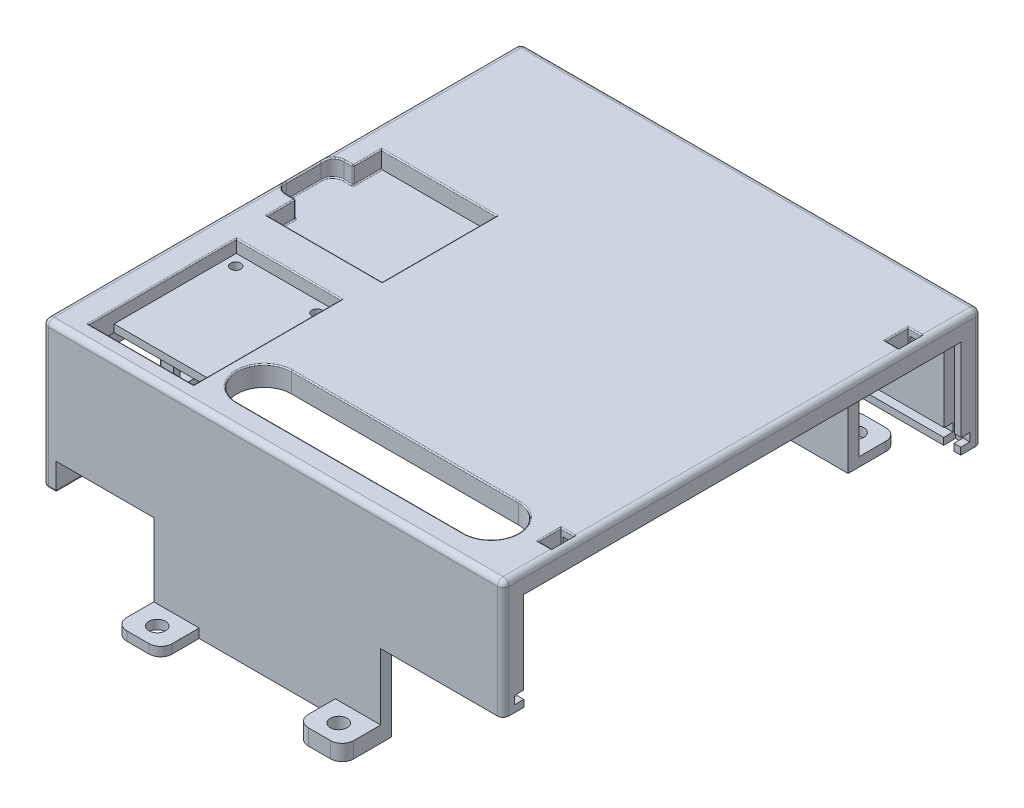
from build123d import *

# Parameters (mm, degrees)
BOSS_EXTRUDE1_DEPTH       = 5.475999969999999
BOSS_EXTRUDE1_DEPTH_BACK  = 93.00000000000006
SKETCH2_R                 = 6.000000000000002
SKETCH2_W                 = 15.829689886761145
SKETCH2_H                 = 13.568305617223942
SKETCH2_W_2               = 35.213904608991875
SKETCH2_H_2               = 19.869660543416312
BOSS_EXTRUDE2_DEPTH       = 3
SKETCH4_W                 = 50.00000000000003
SKETCH4_H                 = 2.400000000000013
SKETCH4_H_2               = 2.3999999999999986
BOSS_EXTRUDE3_DEPTH       = 18.062215133
SKETCH6_W                 = 10.000000000000004
SKETCH6_H                 = 2
SKETCH6_W_2               = 10.000000000000007
BOSS_EXTRUDE4_DEPTH       = 8.5
SKETCH7_W                 = 10.000000000000007
SKETCH7_H                 = 2.0000000000000018
BOSS_EXTRUDE5_DEPTH       = 8.5
F_6_CLEARANCE_HOLE1_D     = 3.6576
F_6_CLEARANCE_HOLE1_DEPTH = 7.62
F_6_CLEARANCE_HOLE1_TIP   = 1.0988539000776023
CUT_EXTRUDE1_DEPTH        = 8.5
CUT_EXTRUDE2_START        = -2.5
CUT_EXTRUDE2_DEPTH        = 101.495879
CUT_EXTRUDE3_DEPTH        = 7.95
CUT_EXTRUDE3_DEPTH_BACK   = 2.5000000000000004
SKETCH13_W                = 3.1000000000000005
SKETCH13_H                = 4.999999999999993
CUT_EXTRUDE4_DEPTH        = 2.794
SKETCH15_W                = 23.11399999999999
SKETCH15_H                = 5.588000000000001
CUT_EXTRUDE5_DEPTH        = 2.794
TAP_DRILL_FOR_4_40_TAP1_D = 2.2606
SKETCH27_W                = 25.32379999999999
SKETCH27_H                = 25.1714
CUT_EXTRUDE6_DEPTH        = 3.8099999999999996
FILLET1_R                 = 1.27
FILLET2_R                 = 1.27
FILLET3_R                 = 1.27
FILLET4_R                 = 0.635
FILLET5_R                 = 0.254
FILLET6_R                 = 0.254
FILLET7_R                 = 2.54
SKETCH28_R                = 1.8287999999999955
BOSS_EXTRUDE7_DEPTH       = 1.5
CUT_EXTRUDE7_DEPTH        = 3.81
FILLET8_R                 = 0.254


# Some blends are built 0.0001 mm under size
with BuildPart() as part:
    # Sketch1 → Boss-Extrude1 (new, two sides: drawn at the far end of the back side and taken through both)
    with BuildSketch(Plane(origin=(0, 0, 0), x_dir=(0, 0, -1), z_dir=(1, 0, 0)).offset(-BOSS_EXTRUDE1_DEPTH_BACK)):
        Polygon((-48.13779143843411, 3.0796649884111265), (-48.13779143843411, 4.601418186900435), (-50.14943480824435, 4.601418186900435), (-50.14943480824435, 6.390822871588028), (-48.24793969226404, 6.390822871588028), (-48.24793969226404, 24.624583150019696), (48.24793969226403, 24.624583150019696), (48.24793969226404, 6.390822871588001), (50.14943480824435, 6.390822871588001), (50.14943480824435, 4.601418186900408), (48.13779143843412, 4.601418186900408), (48.13779143843412, 3.079664988411099), (52.68943480824434, 3.0796649884111127), (52.68943480824434, 8.930822871588001), (52.68943480824434, 29.06607826600001), (-52.68943480824435, 29.066078265999995), (-52.68943480824434, 3.0796649884111407), align=None)
    extrude(amount=BOSS_EXTRUDE1_DEPTH + BOSS_EXTRUDE1_DEPTH_BACK)

    # Sketch2 → Boss-Extrude2 (add)
    with BuildSketch(Plane.ZY.offset(93.00000000000006)):
        Polygon((-52.68943480824434, 29.06607826600001), (52.68943480824434, 29.06607826600001), (52.68943480824434, -3.001942749449555), (-52.68943480824436, -3.001942749449568), align=None)
        with Locations((-38.91314725267847, 11.362022302600375)):
            Circle(SKETCH2_R, mode=Mode.SUBTRACT)
        with Locations((34.72912206967363, 12.140778263538113)):
            Rectangle(SKETCH2_W, SKETCH2_H, mode=Mode.SUBTRACT)
        Polygon((8.044787689133997, 12.819193544399308), (25.45744656457108, 12.819193544399308), (25.45744656457108, 3.676739997555563), (8.044787689133999, 3.676739997555563), align=None, mode=Mode.SUBTRACT)
        with Locations((-13.01457994448496, 13.80130177025359)):
            Rectangle(SKETCH2_W_2, SKETCH2_H_2, mode=Mode.SUBTRACT)
    extrude(amount=BOSS_EXTRUDE2_DEPTH)

    # Sketch4 → Boss-Extrude3 (add)
    with BuildSketch(Plane.XZ.offset(-3.0796649884109524)):
        with Locations((-46.50000000000003, -51.48943480824434)):
            Rectangle(SKETCH4_W, SKETCH4_H)
        with Locations((-46.50000000000003, 51.489434808244326)):
            Rectangle(SKETCH4_W, SKETCH4_H_2)
    extrude(amount=BOSS_EXTRUDE3_DEPTH)

    # Sketch6 → Boss-Extrude4 (add)
    with BuildSketch(Plane(origin=(0, 0, -52.68943480824434), x_dir=(-1, 0, 0), z_dir=(0, 0, -1))):
        with Locations((26.50000000000002, -13.98255014419561)):
            Rectangle(SKETCH6_W, SKETCH6_H)
        with Locations((66.50000000000004, -13.982550144195578)):
            Rectangle(SKETCH6_W_2, SKETCH6_H)
    extrude(amount=BOSS_EXTRUDE4_DEPTH)

    # Sketch7 → Boss-Extrude5 (add)
    with BuildSketch(Plane.XY.offset(52.68943480824434)):
        with Locations((-66.50000000000004, -13.982550144195606)):
            Rectangle(SKETCH7_W, SKETCH7_H)
        Polygon((-21.500000000000018, -14.982550144195638), (-31.50000000000002, -14.98255014419564), (-31.50000000000002, -12.982550144195644), (-21.500000000000018, -12.98255014419564), align=None)
    extrude(amount=BOSS_EXTRUDE5_DEPTH)

    # #6 Clearance Hole1
    with Locations(Plane(origin=(0, -12.982550144195619, 0), x_dir=(1, 0, 0), z_dir=(0, 1, 0))):
        with Locations((-66.5, -56.939434808), (-26.5, -56.939434808), (-26.5, 56.939434808), (-66.5, 56.939434808)):
            Hole(F_6_CLEARANCE_HOLE1_D / 2, depth=F_6_CLEARANCE_HOLE1_DEPTH)
            with Locations((0, 0, -(F_6_CLEARANCE_HOLE1_DEPTH + F_6_CLEARANCE_HOLE1_TIP / 2))):  # 118° drill point
                Cone(0, F_6_CLEARANCE_HOLE1_D / 2, F_6_CLEARANCE_HOLE1_TIP, mode=Mode.SUBTRACT)

    # Sketch11 → Cut-Extrude1 (cut)
    with BuildSketch(Plane(origin=(0, 29.066078266, 3.83e-15), x_dir=(1, 0, 0), z_dir=(0, 1, 0))):
        with BuildLine():
            Line((-58.40000569495746, -35.45524070675196), (-8.400003310771842, -35.45524070675196))
            ThreePointArc((-8.400003310771842, -35.45524070675196), (-2.400003310771849, -41.45524070675195), (-8.400003310771842, -47.455240706751944))
            Line((-8.400003310771842, -47.455240706751944), (-58.40000569495746, -47.455240706751944))
            ThreePointArc((-58.40000569495746, -47.455240706751944), (-64.40000569495746, -41.45524070675195), (-58.40000569495746, -35.45524070675196))
        make_face()
    extrude(amount=-CUT_EXTRUDE1_DEPTH, mode=Mode.SUBTRACT)

    # Sketch12 → Cut-Extrude2 (cut)
    with BuildSketch(Plane.XY.offset(-48.24793969226404).offset(CUT_EXTRUDE2_START)):
        Polygon((1.7259999699999997, 27.56607826599999), (3.9759999699999997, 27.56607826599999), (3.9759999700000033, 3.0796649884110807), (1.7259999700000028, 3.0796649884110807), align=None)
    extrude(amount=CUT_EXTRUDE2_DEPTH, mode=Mode.SUBTRACT)

    # Sketch13 → Cut-Extrude3 (cut, two sides: drawn at the far end of the back side and taken through both)
    with BuildSketch(Plane.XZ.offset(-27.56607826600001).offset(-CUT_EXTRUDE3_DEPTH_BACK)):
        Polygon((1.3009999699999995, 40.74793969226404), (4.40099997, 40.74793969226404), (4.400999969999999, 35.74793969226405), (1.30099997, 35.74793969226405), align=None)
        with Locations((2.8509999699999997, -38.24793969226404)):
            Rectangle(SKETCH13_W, SKETCH13_H)
    extrude(amount=CUT_EXTRUDE3_DEPTH + CUT_EXTRUDE3_DEPTH_BACK, mode=Mode.SUBTRACT)

    # Sketch14 → Cut-Extrude4 (cut)
    with BuildSketch(Plane(origin=(0, 29.066078266, 3.83e-15), x_dir=(1, 0, 0), z_dir=(0, 1, -4e-16))):
        Polygon((-89.65000000000006, -16.367434808244354), (-66.53600000000007, -16.367434808244358), (-66.53600000000007, -48.87943480824436), (-89.65000000000006, -48.879434808244355), align=None)
    extrude(amount=-CUT_EXTRUDE4_DEPTH, mode=Mode.SUBTRACT)

    # Sketch15 → Cut-Extrude5 (cut)
    with BuildSketch(Plane(origin=(0, 26.272078266, -1.121e-14), x_dir=(1, 0, 0), z_dir=(0, 1, -4.3e-16))):
        with Locations((-78.09300000000007, -46.085434808244344)):
            Rectangle(SKETCH15_W, SKETCH15_H)
    extrude(amount=-CUT_EXTRUDE5_DEPTH, mode=Mode.SUBTRACT)

    # Tap Drill for #4-40 Tap1 (through all)
    with Locations(Plane(origin=(-87.2751, 26.272078266, 18.869334808), x_dir=(0, 0, 1), z_dir=(0, 1, 0))):
        with Locations((0, 0), (0, 17.907)):
            Hole(TAP_DRILL_FOR_4_40_TAP1_D / 2)

    # Sketch27 → Cut-Extrude6 (cut)
    with BuildSketch(Plane(origin=(0, 29.066078266, 3.83e-15), x_dir=(1, 0, 0), z_dir=(0, 1, -4e-16))):
        with Locations((-78.03199360563266, 4.095532442078496)):
            Rectangle(SKETCH27_W, SKETCH27_H)
    extrude(amount=-CUT_EXTRUDE6_DEPTH, mode=Mode.SUBTRACT)

    # Fillet1
    # the kernel refuses this fillet: 1.27 mm, written as the material it takes off along each edge
    with BuildSketch(Plane(origin=(5.475999969999999, 29.06607826600001, -55.86443480824434), x_dir=(-7e-16, -1, -1.3e-16), z_dir=(0, -1.3e-16, 1))) as fillet1_piece_1:
        with BuildLine():
            CenterArc((FILLET1_R, -FILLET1_R), FILLET1_R, 90.00000000000004, 89.99999999999996)
            Line((8.9e-16, -FILLET1_R), (0, 0))
            Line((0, 0), (FILLET1_R, 0))
        make_face()
    extrude(amount=111.72886961648868, mode=Mode.SUBTRACT)
    with BuildSketch(Plane(origin=(-99.17500000000007, 29.06607826600001, -52.68943480824434), x_dir=(0, -1, 0), z_dir=(1, 0, 0))) as fillet1_piece_2:
        with BuildLine():
            CenterArc((FILLET1_R, -FILLET1_R), FILLET1_R, 90, 90)
            Line((0, -FILLET1_R), (0, 0))
            Line((0, 0), (FILLET1_R, 0))
        make_face()
    extrude(amount=107.82599997000007, mode=Mode.SUBTRACT)
    with BuildSketch(Plane(origin=(-96.00000000000006, 29.06607826600001, -55.86443480824434), x_dir=(1, 0, 0), z_dir=(0, 0, 1))) as fillet1_piece_3:
        with BuildLine():
            CenterArc((FILLET1_R, -FILLET1_R), FILLET1_R, 90, 90)
            Line((0, -FILLET1_R), (0, 0))
            Line((0, 0), (FILLET1_R, 0))
        make_face()
    extrude(amount=111.72886961648868, mode=Mode.SUBTRACT)
    with BuildSketch(Plane(origin=(8.650999970000026, 29.066078265999995, 52.68943480824435), x_dir=(-1.4e-16, -1, 0), z_dir=(-1, 1.4e-16, -7e-17))) as fillet1_piece_4:
        with BuildLine():
            CenterArc((FILLET1_R, -FILLET1_R), FILLET1_R, 90, 90)
            Line((0, -FILLET1_R), (0, 0))
            Line((0, 0), (FILLET1_R, 0))
        make_face()
    extrude(amount=107.82599997000011, mode=Mode.SUBTRACT)

    # Fillet2
    # the kernel refuses this fillet: 1.27 mm, written as the material it takes off along each edge
    with BuildSketch(Plane(origin=(-94.73000000000006, 27.79607826600001, -51.41943480824434), x_dir=(-1, 0, 0), z_dir=(0, 0, -1))) as fillet2_piece_1_section:
        Polygon((0, 0), (FILLET2_R * 1.02, 0), (FILLET2_R * 1.02, FILLET2_R * 1.02), (0, FILLET2_R * 1.02), align=None)
    fillet2_piece_1 = extrude(amount=FILLET2_R * 1.02, mode=Mode.PRIVATE)
    fillet2_piece_1 = fillet2_piece_1 - Plane(origin=(-94.73000000000006, 27.79607826600001, -51.41943480824434), x_dir=(0.7071067811865475, -0.7071067811865475, 0), z_dir=(0, 0, -1)) * Sphere(FILLET2_R, mode=Mode.PRIVATE)
    add(fillet2_piece_1, mode=Mode.SUBTRACT)
    with BuildSketch(Plane(origin=(-94.73000000000006, 27.796078265999995, 51.41943480824435), x_dir=(-1, 0, 0), z_dir=(0, -2.7e-16, 1))) as fillet2_piece_2_section:
        Polygon((0, 0), (FILLET2_R * 1.02, 0), (FILLET2_R * 1.02, -FILLET2_R * 1.02), (0, -FILLET2_R * 1.02), align=None)
    fillet2_piece_2 = extrude(amount=FILLET2_R * 1.02, mode=Mode.PRIVATE)
    fillet2_piece_2 = fillet2_piece_2 - Plane(origin=(-94.73000000000006, 27.796078265999995, 51.41943480824435), x_dir=(0.7071067811865475, -0.7071067811865475, 0), z_dir=(0, -2.7e-16, 1)) * Sphere(FILLET2_R, mode=Mode.PRIVATE)
    add(fillet2_piece_2, mode=Mode.SUBTRACT)
    with BuildSketch(Plane(origin=(4.205999969999999, 27.79607826600001, -51.41943480824434), x_dir=(0, 0, -1), z_dir=(1, 0, 0))) as fillet2_piece_3_section:
        Polygon((0, 0), (FILLET2_R * 1.02, 0), (FILLET2_R * 1.02, FILLET2_R * 1.02), (-1.7e-16, FILLET2_R * 1.02), align=None)
    fillet2_piece_3 = extrude(amount=FILLET2_R * 1.02, mode=Mode.PRIVATE)
    fillet2_piece_3 = fillet2_piece_3 - Plane(origin=(4.205999969999999, 27.79607826600001, -51.41943480824434), x_dir=(0, -0.7071067811865476, 0.7071067811865475), z_dir=(1, 0, 0)) * Sphere(FILLET2_R, mode=Mode.PRIVATE)
    add(fillet2_piece_3, mode=Mode.SUBTRACT)
    with BuildSketch(Plane(origin=(4.205999969999999, 27.796078265999995, 51.41943480824435), x_dir=(0, -2.7e-16, 1), z_dir=(1, 0, 0))) as fillet2_piece_4_section:
        Polygon((0, 0), (FILLET2_R * 1.02, 0), (FILLET2_R * 1.02, -FILLET2_R * 1.02), (-1.8e-16, -FILLET2_R * 1.02), align=None)
    fillet2_piece_4 = extrude(amount=FILLET2_R * 1.02, mode=Mode.PRIVATE)
    fillet2_piece_4 = fillet2_piece_4 - Plane(origin=(4.205999969999999, 27.796078265999995, 51.41943480824435), x_dir=(0, -0.7071067811865474, -0.7071067811865477), z_dir=(1, 0, 0)) * Sphere(FILLET2_R, mode=Mode.PRIVATE)
    add(fillet2_piece_4, mode=Mode.SUBTRACT)
    with BuildSketch(Plane(origin=(5.475999969999999, 27.796078266000002, 52.68943480824435), x_dir=(-7e-16, 2.7e-16, -1), z_dir=(0, -1, -2.7e-16))) as fillet2_piece_5:
        with BuildLine():
            CenterArc((FILLET2_R, -FILLET2_R), FILLET2_R, 90.00000000000004, 89.99999999999996)
            Line((8.9e-16, -FILLET2_R), (0, 0))
            Line((0, 0), (FILLET2_R, 0))
        make_face()
    extrude(amount=27.891413277588867, mode=Mode.SUBTRACT)
    with BuildSketch(Plane(origin=(-96.00000000000006, -6.1769427494495766, -52.68943480824434), x_dir=(1, 0, 0), z_dir=(0, 1, 4.4e-16))) as fillet2_piece_6:
        with BuildLine():
            CenterArc((FILLET2_R, -FILLET2_R), FILLET2_R, 90, 90)
            Line((0, -FILLET2_R), (0, 0))
            Line((0, 0), (FILLET2_R, 0))
        make_face()
    extrude(amount=33.973021015449575, mode=Mode.SUBTRACT)
    with BuildSketch(Plane(origin=(5.475999969999999, 27.796078266000002, -52.68943480824434), x_dir=(-7e-16, 0, 1), z_dir=(0, -1, 0))) as fillet2_piece_7:
        with BuildLine():
            CenterArc((FILLET2_R, FILLET2_R), FILLET2_R, 180, 89.99999999999994)
            Line((8.9e-16, FILLET2_R), (0, 0))
            Line((0, 0), (FILLET2_R, 0))
        make_face()
    extrude(amount=27.891413277588896, mode=Mode.SUBTRACT)
    with BuildSketch(Plane(origin=(-96.00000000000006, 27.796078266000002, 52.68943480824434), x_dir=(1, 0, 5.59e-15), z_dir=(0, -1, 0))) as fillet2_piece_8:
        with BuildLine():
            CenterArc((FILLET2_R, -FILLET2_R), FILLET2_R, 89.99999999999969, 90.00000000000031)
            Line((-7.11e-15, -FILLET2_R), (0, 0))
            Line((0, 0), (FILLET2_R, 0))
        make_face()
    extrude(amount=33.97302101544956, mode=Mode.SUBTRACT)

    # Fillet3
    fillet3_edges = [part.edges().sort_by_distance(p)[0] for p in [
        (-94.50000000000006, 5.356625454926142, 26.814277126293057),
        (-94.50000000000006, 5.356625454926142, 42.6439670130542),
        (-94.50000000000006, 18.924931072150084, 42.6439670130542),
        (-94.50000000000006, 18.924931072150084, 26.814277126293057),
        (-94.50000000000006, 3.676739997555563, 8.044787689133999),
        (-94.50000000000006, 3.676739997555563, 25.45744656457108),
        (-94.50000000000006, 12.819193544399308, 25.45744656457108),
        (-94.50000000000006, 12.819193544399308, 8.044787689133997),
        (-94.50000000000006, 3.8664714985454327, -30.6215322489809),
        (-94.50000000000006, 3.8664714985454327, 4.592372360010977),
        (-94.50000000000006, 23.736132041961746, 4.592372360010977),
        (-94.50000000000006, 23.736132041961746, -30.6215322489809),
    ]]
    fillet(fillet3_edges, radius=FILLET3_R)

    # Fillet4
    fillet4_edges = [part.edges().sort_by_distance(p)[0] for p in [
        (-93.86500000000004, -3.001942749449555, 52.68943480824434),
        (-93.86500000000004, -3.001942749449568, -52.68943480824436),
        (-96.00000000000006, -3.001942749449561, 7.11e-15),
        (-95.62802561210692, -3.0019427494495545, 52.31746042035091),
        (-95.62802561210692, -3.0019427494495674, -52.31746042035091),
        (-93.00000000000006, -3.001942749449561, -7.11e-15),
    ]]
    fillet(fillet4_edges, radius=FILLET4_R)

    # Fillet5
    fillet5_edges = [part.edges().sort_by_distance(p)[0] for p in [
        (-96.00000000000006, 8.247966770977436, 8.044787689133997),
        (-96.00000000000006, 3.676739997555563, 16.751117126852538),
        (-96.00000000000006, 5.356625454926142, 34.72912206967363),
        (-96.00000000000006, 12.140778263538113, 42.6439670130542),
        (-96.00000000000006, 12.140778263538113, 26.814277126293057),
        (-96.00000000000006, 18.924931072150084, 34.72912206967363),
        (-96.00000000000006, 8.247966770977435, 25.45744656457108),
        (-96.00000000000006, 12.819193544399308, 16.751117126852538),
        (-96.00000000000006, 3.8664714985454327, -13.01457994448496),
        (-96.00000000000006, 13.80130177025359, 4.592372360010977),
        (-96.00000000000006, 13.80130177025359, -30.6215322489809),
        (-96.00000000000006, 23.736132041961746, -13.01457994448496),
        (-96.00000000000006, 4.048714385448648, 8.416762077027082),
        (-96.00000000000006, 5.728599842819227, 42.27199262516111),
        (-96.00000000000006, 5.728599842819228, 27.18625151418614),
        (-96.00000000000006, 18.552956684257, 27.18625151418614),
        (-96.00000000000006, 18.552956684257, 42.27199262516111),
        (-96.00000000000006, 12.447219156506224, 25.085472176677996),
        (-96.00000000000006, 4.048714385448648, 25.085472176677996),
        (-96.00000000000006, 12.447219156506224, 8.416762077027082),
        (-96.00000000000006, 4.238445886438518, 4.220397972117892),
        (-96.00000000000006, 4.238445886438516, -30.249557861087812),
        (-96.00000000000006, 23.364157654068663, 4.220397972117892),
        (-96.00000000000006, 23.364157654068663, -30.249557861087816),
        (-96.00000000000006, 11.362022302600373, -44.91314725267847),
    ]]
    fillet(fillet5_edges, radius=FILLET5_R)

    # Fillet6
    fillet6_edges = [part.edges().sort_by_distance(p)[0] for p in [
        (-64.40000569495746, 29.066078266, 41.45524070675196),
        (-33.40000450286465, 29.066078266, 47.45524070675195),
        (-2.4000033107718517, 29.066078266, 41.45524070675196),
        (-33.40000450286465, 29.066078266, 35.455240706751965),
        (1.3009999699999992, 29.066078266000005, -38.24793969226404),
        (1.3009999699999997, 29.066078265999998, 38.24793969226404),
        (2.75349997, 29.066078265999995, 40.74793969226404),
        (2.75349997, 29.066078266000005, -35.74793969226405),
        (-78.09300000000007, 29.06607826600001, 16.367434808244358),
        (-66.53600000000007, 29.066078266000016, 32.62343480824436),
        (-89.65000000000006, 29.066078266000016, 32.62343480824436),
        (-78.09300000000007, 29.06607826600002, 48.87943480824436),
        (-90.69389360563265, 29.066078266, -4.0955324420784915),
        (-78.03199360563266, 29.066078266000005, 8.490167557921508),
        (-65.37009360563266, 29.066078266, -4.095532442078493),
        (-78.03199360563266, 29.066078265999995, -16.681232442078493),
        (2.75349997, 29.06607826600001, -40.74793969226404),
        (2.75349997, 29.066078265999998, 35.74793969226404),
        (4.303790302399113, 29.062307728178666, 40.74793969226404),
        (4.303790302399112, 29.062307728178666, 35.747939692264055),
        (4.303790302399112, 29.062307728178666, -35.74793969226405),
        (4.303790302399112, 29.062307728178666, -40.74793969226404),
    ]]
    fillet(fillet6_edges, radius=FILLET6_R)

    # Fillet7
    fillet7_edges = [part.edges().sort_by_distance(p)[0] for p in [
        (-21.500000000000018, -13.982550144195612, -61.18943480824434),
        (-31.50000000000002, -13.982550144195612, -61.18943480824434),
        (-71.50000000000004, -13.982550144195576, -61.18943480824434),
        (-61.500000000000036, -13.982550144195578, -61.18943480824434),
        (-71.50000000000004, -13.982550144195619, 61.18943480824434),
        (-61.500000000000036, -13.982550144195619, 61.18943480824434),
        (-21.500000000000018, -13.982550144195653, 61.18943480824434),
        (-31.50000000000002, -13.982550144195656, 61.18943480824434),
    ]]
    fillet(fillet7_edges, radius=FILLET7_R)

    # Sketch28 → Boss-Extrude7 (add)
    with BuildSketch(Plane(origin=(4.5e-15, -12.982550144195647, 0), x_dir=(1, 3.5e-16, 0), z_dir=(-3.5e-16, 1, 0))):
        with BuildLine():
            Line((-31.50000000000003, -52.68943480824434), (-31.50000000000003, -58.64943480824432))
            ThreePointArc((-31.50000000000003, -58.64943480824432), (-30.756051224213863, -60.44548603245818), (-28.96000000000001, -61.18943480824435))
            Line((-28.96000000000001, -61.18943480824435), (-24.040000000000042, -61.18943480824435))
            ThreePointArc((-24.040000000000042, -61.18943480824435), (-22.243948775786187, -60.44548603245818), (-21.50000000000002, -58.64943480824432))
            Line((-21.50000000000002, -58.64943480824432), (-21.50000000000002, -52.68943480824434))
            Line((-21.50000000000002, -52.68943480824434), (-31.50000000000003, -52.68943480824434))
        make_face()
        with Locations((-26.500000000000025, -56.939434808244314)):
            Circle(SKETCH28_R, mode=Mode.SUBTRACT)
    extrude(amount=BOSS_EXTRUDE7_DEPTH)

    # Sketch29 → Cut-Extrude7 (cut)
    with BuildSketch(Plane(origin=(0, 29.066078266, 3.83e-15), x_dir=(1, 0, 0), z_dir=(0, 1, 1.3e-16))):
        with BuildLine():
            Line((-90.69389360563265, 10.445532442078497), (-92.72589360563265, 10.445532442078497))
            ThreePointArc((-92.72589360563265, 10.445532442078497), (-94.52194482984648, 9.701583666292327), (-95.26589360563264, 7.905532442078496))
            Line((-95.26589360563264, 7.905532442078496), (-95.26589360563264, 0.285532442078496))
            ThreePointArc((-95.26589360563264, 0.285532442078496), (-94.52194482984648, -1.5105187821353339), (-92.72589360563265, -2.2544675579215028))
            Line((-92.72589360563265, -2.2544675579215028), (-90.69389360563265, -2.2544675579215037))
            Line((-90.69389360563265, -2.2544675579215037), (-90.69389360563265, 10.445532442078497))
        make_face()
    extrude(amount=-CUT_EXTRUDE7_DEPTH, mode=Mode.SUBTRACT)

    # Fillet8
    fillet8_edges = [part.edges().sort_by_distance(p)[0] for p in [
        (-90.76828848321128, 28.991683388421375, -10.445532442078495),
        (-90.76828848321128, 28.99168338842138, 2.254467557921508),
        (-95.13022761226775, 29.0013657519684, -8.724542891954329),
        (-95.26589360563264, 28.94747656521798, -4.095532442078493),
        (-95.13022747558092, 29.001365797513383, 0.5334784095014863),
        (-90.69389360563265, 25.256078266000006, 5.372317557921508),
        (-93.84122588553613, 29.066078266, 1.9964916387333858),
        (-91.83689360563265, 29.066078266, 2.254467557921507),
        (-91.83689360563265, 29.066078266, -10.445532442078493),
        (-93.84122588553613, 29.066078266, -10.187556522890372),
        (-90.69389360563265, 27.034078265999998, -10.445532442078493),
        (-90.69389360563265, 27.034078265999998, 2.254467557921507),
        (-91.70989360563266, 25.256078266000003, 2.2544675579215063),
        (-94.52194482984648, 25.256078266000003, 1.5105187821353372),
        (-95.26589360563264, 25.256078266000003, -4.095532442078492),
        (-94.52194482984648, 25.256078266000003, -9.701583666292324),
        (-91.70989360563266, 25.256078266000003, -10.445532442078493),
        (-90.69389360563265, 25.256078265999996, -13.563382442078492),
    ]]
    fillet(fillet8_edges, radius=FILLET8_R - 0.0001)  # a hair under: the kernel refuses the full size


solid = part.part
